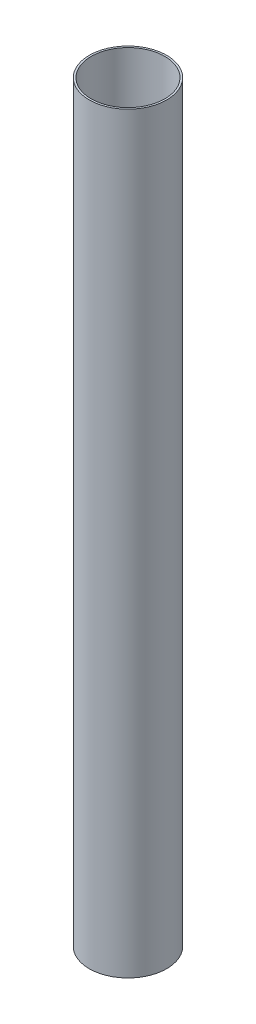
from build123d import *

# Parameters (mm, degrees)
SKETCH1_R           = 41.15
SKETCH1_R_2         = 39.15
BOSS_EXTRUDE1_DEPTH = 800


with BuildPart() as part:
    # Sketch1 → Boss-Extrude1 (new body)
    with BuildSketch(Plane(origin=(0, 0, 0), x_dir=(1, 0, 0), z_dir=(0, 1, 0))):
        Circle(SKETCH1_R)
        Circle(SKETCH1_R_2, mode=Mode.SUBTRACT)
    extrude(amount=BOSS_EXTRUDE1_DEPTH)


solid = part.part
